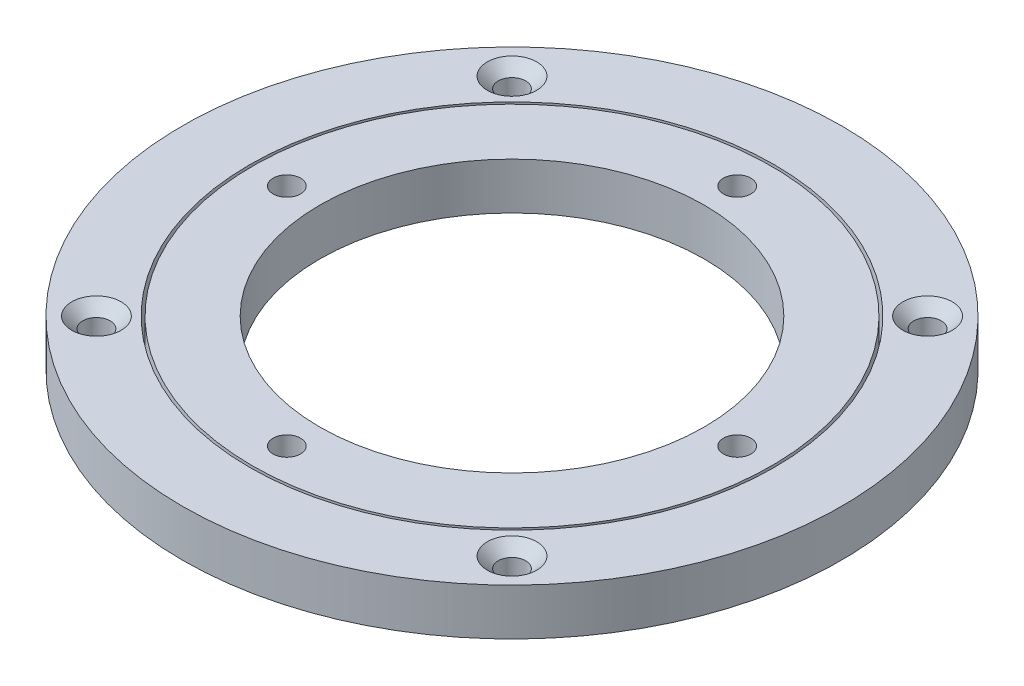
from build123d import *

# Parameters (mm, degrees)
SKETCH_1_R        = 60
SKETCH_1_R_2      = 47.75
SKETCH_1_R_3      = 2.5
EXTRUDE_1_DEPTH   = 8.5
SKETCH_1_R_4      = 47.25
SKETCH_1_R_5      = 35
EXTRUDE_1_2_DEPTH = 8.5


# Read off the part's stored shape, not the designer's step: 打孔尺寸(%根据)内六角花形半沉头螺钉的类型1
with BuildPart() as part:
    # 草图1 → 凸台-拉伸1 (new body)
    with BuildSketch(Plane(origin=(0, 0, 0), x_dir=(1, 0, 0), z_dir=(0, 1, 0))):
        with Locations(Location((0, 0, 0), (0, 0, 270))):
            Circle(SKETCH_1_R)
        with Locations(Location((0, 0, 0), (0, 0, 270))):
            Circle(SKETCH_1_R_2, mode=Mode.SUBTRACT)
        with Locations(Location((37.830212793, -37.830212793, 0), (0, 0, 270))):
            Circle(SKETCH_1_R_3, mode=Mode.SUBTRACT)
        with Locations(Location((-37.830212793, -37.830212793, 0), (0, 0, 270))):
            Circle(SKETCH_1_R_3, mode=Mode.SUBTRACT)
        with Locations(Location((-37.830212793, 37.830212793, 0), (0, 0, 270))):
            Circle(SKETCH_1_R_3, mode=Mode.SUBTRACT)
        with Locations(Location((37.830212793, 37.830212793, 0), (0, 0, 270))):
            Circle(SKETCH_1_R_3, mode=Mode.SUBTRACT)
    extrude(amount=EXTRUDE_1_DEPTH)

    # Hole Wizard 1 5 outline → Hole Wizard 1 5 (revolve, cut)
    with BuildSketch(Plane(origin=(-37.830212793, 0, 37.830212793), x_dir=(1, 0, 0), z_dir=(0, 0, 1))):
        Polygon((2.5, 8.5), (2.5, 6.5), (4.5, 8.5), align=None)
    revolve(axis=Axis((-37.830212793, 0, 37.830212793), (0, 1, 0)), mode=Mode.SUBTRACT)

    # Hole Wizard 1 6 outline → Hole Wizard 1 6 (revolve, cut)
    with BuildSketch(Plane(origin=(37.830212793, 0, 37.830212793), x_dir=(1, 0, 0), z_dir=(0, 0, 1))):
        Polygon((2.5, 8.5), (2.5, 6.5), (4.5, 8.5), align=None)
    revolve(axis=Axis((37.830212793, 0, 37.830212793), (0, 1, 0)), mode=Mode.SUBTRACT)

    # Hole Wizard 1 7 outline → Hole Wizard 1 7 (revolve, cut)
    with BuildSketch(Plane(origin=(37.830212793, 0, -37.830212793), x_dir=(1, 0, 0), z_dir=(0, 0, 1))):
        Polygon((2.5, 8.5), (2.5, 6.5), (4.5, 8.5), align=None)
    revolve(axis=Axis((37.830212793, 0, -37.830212793), (0, 1, 0)), mode=Mode.SUBTRACT)

    # Hole Wizard 1 8 outline → Hole Wizard 1 8 (revolve, cut)
    with BuildSketch(Plane(origin=(-37.830212793, 0, -37.830212793), x_dir=(1, 0, 0), z_dir=(0, 0, 1))):
        Polygon((2.5, 8.5), (2.5, 6.5), (4.5, 8.5), align=None)
    revolve(axis=Axis((-37.830212793, 0, -37.830212793), (0, 1, 0)), mode=Mode.SUBTRACT)


with BuildPart() as body_2:
    # 草图1 → Extrude 1 2 (new body)
    with BuildSketch(Plane(origin=(0, 0, 0), x_dir=(1, 0, 0), z_dir=(0, 1, 0))):
        with Locations(Location((0, 0, 0), (0, 0, 270))):
            Circle(SKETCH_1_R_4)
        with Locations(Location((0, -41, 0), (0, 0, 270))):
            Circle(SKETCH_1_R_3, mode=Mode.SUBTRACT)
        with Locations(Location((-41, 0, 0), (0, 0, 270))):
            Circle(SKETCH_1_R_3, mode=Mode.SUBTRACT)
        with Locations(Location((0, 41, 0), (0, 0, 270))):
            Circle(SKETCH_1_R_3, mode=Mode.SUBTRACT)
        with Locations(Location((41, 0, 0), (0, 0, 270))):
            Circle(SKETCH_1_R_3, mode=Mode.SUBTRACT)
        with Locations(Location((0, 0, 0), (0, 0, 270))):
            Circle(SKETCH_1_R_5, mode=Mode.SUBTRACT)
    extrude(amount=EXTRUDE_1_2_DEPTH)

    # 打孔尺寸(%根据)内六角花形半沉头螺钉的类型1 outline → 打孔尺寸(%根据)内六角花形半沉头螺钉的类型1 (revolve, cut)
    with BuildSketch(Plane.XY.offset(-41)):
        Polygon((4.5, 0), (2.5, 2), (2.5, 0), align=None)
    revolve(axis=Axis((0, 0, -41), (0, 1, 0)), mode=Mode.SUBTRACT)

    # Hole Wizard 1 2 outline → Hole Wizard 1 2 (revolve, cut)
    with BuildSketch(Plane(origin=(41, 0, 0), x_dir=(1, 0, 0), z_dir=(0, 0, 1))):
        Polygon((4.5, 0), (2.5, 2), (2.5, 0), align=None)
    revolve(axis=Axis((41, 0, 0), (0, 1, 0)), mode=Mode.SUBTRACT)

    # Hole Wizard 1 3 outline → Hole Wizard 1 3 (revolve, cut)
    with BuildSketch(Plane.XY.offset(41)):
        Polygon((4.5, 0), (2.5, 2), (2.5, 0), align=None)
    revolve(axis=Axis((0, 0, 41), (0, 1, 0)), mode=Mode.SUBTRACT)

    # Hole Wizard 1 4 outline → Hole Wizard 1 4 (revolve, cut)
    with BuildSketch(Plane(origin=(-41, 0, 0), x_dir=(1, 0, 0), z_dir=(0, 0, 1))):
        Polygon((4.5, 0), (2.5, 2), (2.5, 0), align=None)
    revolve(axis=Axis((-41, 0, 0), (0, 1, 0)), mode=Mode.SUBTRACT)


solid = Compound([part.part, body_2.part])
